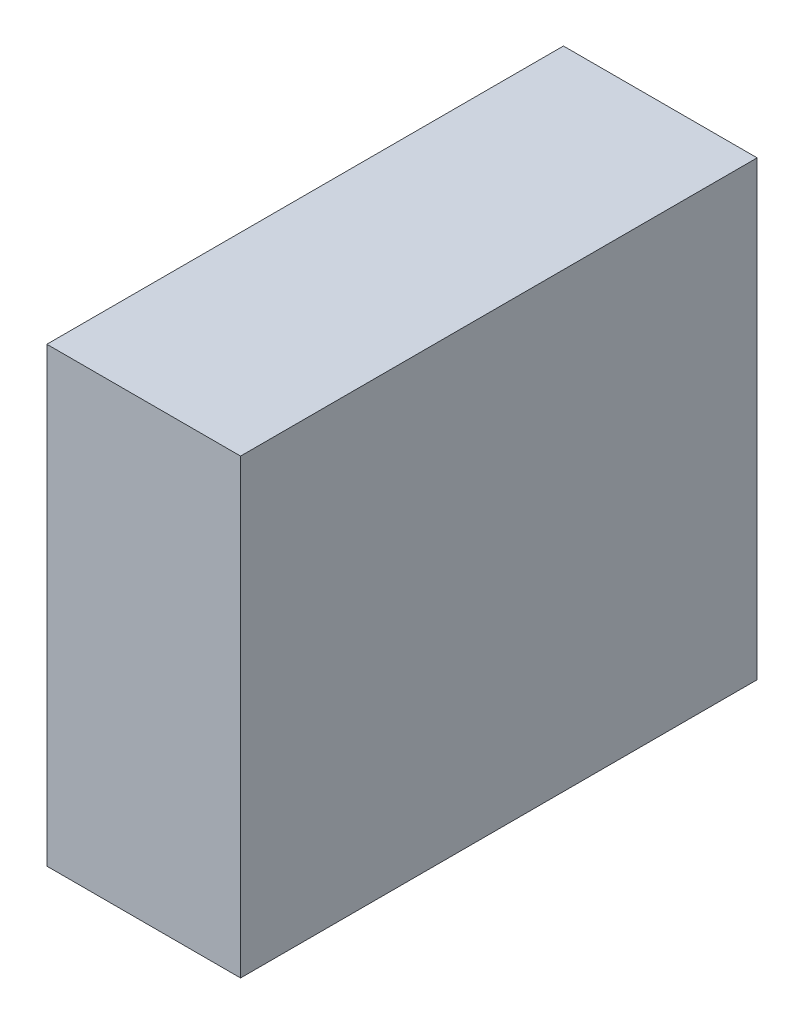
from build123d import *

# Parameters (mm, degrees)
SKETCH1_W           = 19.05
SKETCH1_H           = 44.45
BOSS_EXTRUDE1_DEPTH = 50.8


with BuildPart() as part:
    # Sketch1 → Boss-Extrude1 (new body)
    with BuildSketch(Plane.XY):
        with Locations((9.525, 22.225)):
            Rectangle(SKETCH1_W, SKETCH1_H)
    extrude(amount=BOSS_EXTRUDE1_DEPTH)


solid = part.part
